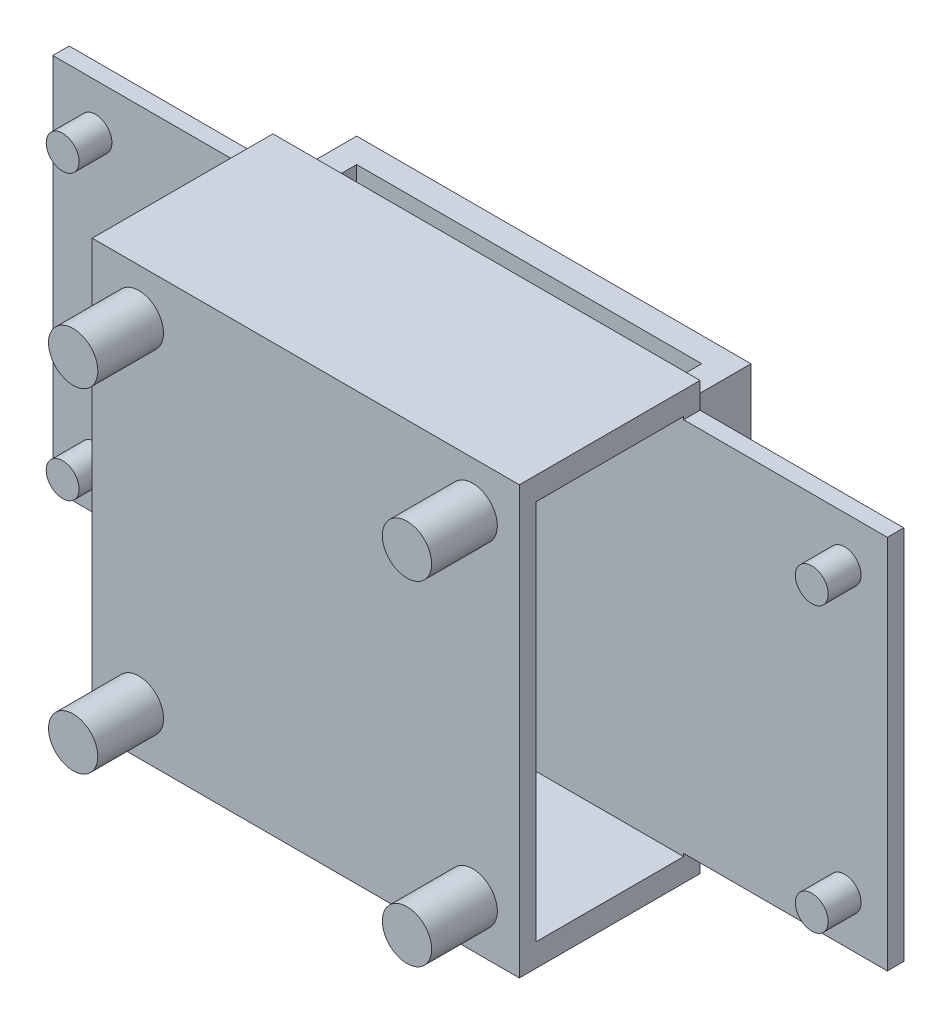
from build123d import *

# Parameters (mm, degrees)
EXTRUDE_1_DEPTH     = 1
SKETCH_3_R          = 1
EXTRUDE_2_DEPTH     = 2
SKETCH_9_W          = 26
SKETCH_9_H          = 1.4
EXTRUDE_4_DEPTH     = 9
SKETCH_10_W         = 26
SKETCH_10_H         = 26
EXTRUDE_5_DEPTH     = 1
SKETCH_11_R         = 1.5
EXTRUDE_6_DEPTH     = 4
SKETCH_6_W          = 24
SKETCH_6_H          = 4
EXTRUDE_7_DEPTH     = 4
SKETCH_12_W         = 21
SKETCH_12_H         = 2
CUT_EXTRUDE_3_DEPTH = 25


with BuildPart() as part:
    # 草图1 → 凸台-拉伸1 (new body)
    with BuildSketch(Plane.XY):
        Polygon((-13, -11.43), (-13, -13), (13, -13), (13, -11.43), (25.4, -11.43), (25.4, 11.43), (13, 11.43), (13, 13), (-13, 13), (-13, 11.43), (-25.4, 11.43), (-25.4, -11.43), align=None)
    extrude(amount=EXTRUDE_1_DEPTH)

    # 草图3 → 凸台-拉伸2 (add)
    with BuildSketch(Plane.XY.offset(1)):
        with Locations((-22.8, -8.63)):
            Circle(SKETCH_3_R)
        with Locations((-22.8, 8.63)):
            Circle(SKETCH_3_R)
        with Locations((22.8, -8.63)):
            Circle(SKETCH_3_R)
        with Locations((22.8, 8.63)):
            Circle(SKETCH_3_R)
    extrude(amount=EXTRUDE_2_DEPTH)

    # 草图9 → 凸台-拉伸4 (add)
    with BuildSketch(Plane.XY.offset(1)):
        with Locations((0, 12.3)):
            Rectangle(SKETCH_9_W, SKETCH_9_H)
        with Locations((0, -12.3)):
            Rectangle(SKETCH_9_W, SKETCH_9_H)
    extrude(amount=EXTRUDE_4_DEPTH)

    # 草图10 → 凸台-拉伸5 (add)
    with BuildSketch(Plane.XY.offset(10)):
        Rectangle(SKETCH_10_W, SKETCH_10_H)
    extrude(amount=EXTRUDE_5_DEPTH)

    # 草图11 → 凸台-拉伸6 (add)
    with BuildSketch(Plane.XY.offset(11)):
        with Locations((-10.16, -10.16)):
            Circle(SKETCH_11_R)
        with Locations((10.16, -10.16)):
            Circle(SKETCH_11_R)
        with Locations((10.16, 10.16)):
            Circle(SKETCH_11_R)
        with Locations((-10.16, 10.16)):
            Circle(SKETCH_11_R)
    extrude(amount=EXTRUDE_6_DEPTH)

    # 草图6 → 凸台-拉伸7 (add)
    with BuildSketch(Plane(origin=(0, 0, 0), x_dir=(-1, 0, 0), z_dir=(0, 0, -1))):
        with Locations((-0.1, 9.43)):
            Rectangle(SKETCH_6_W, SKETCH_6_H)
        with Locations((-0.1, -9.43)):
            Rectangle(SKETCH_6_W, SKETCH_6_H)
    extrude(amount=EXTRUDE_7_DEPTH)

    # 草图12 → 切除-拉伸3 (cut)
    with BuildSketch(Plane(origin=(0, -11.43, 0), x_dir=(-1, 0, 0), z_dir=(0, -1, 0))):
        with Locations((-0.1, 1.5)):
            Rectangle(SKETCH_12_W, SKETCH_12_H)
    extrude(amount=-CUT_EXTRUDE_3_DEPTH, mode=Mode.SUBTRACT)


solid = part.part
